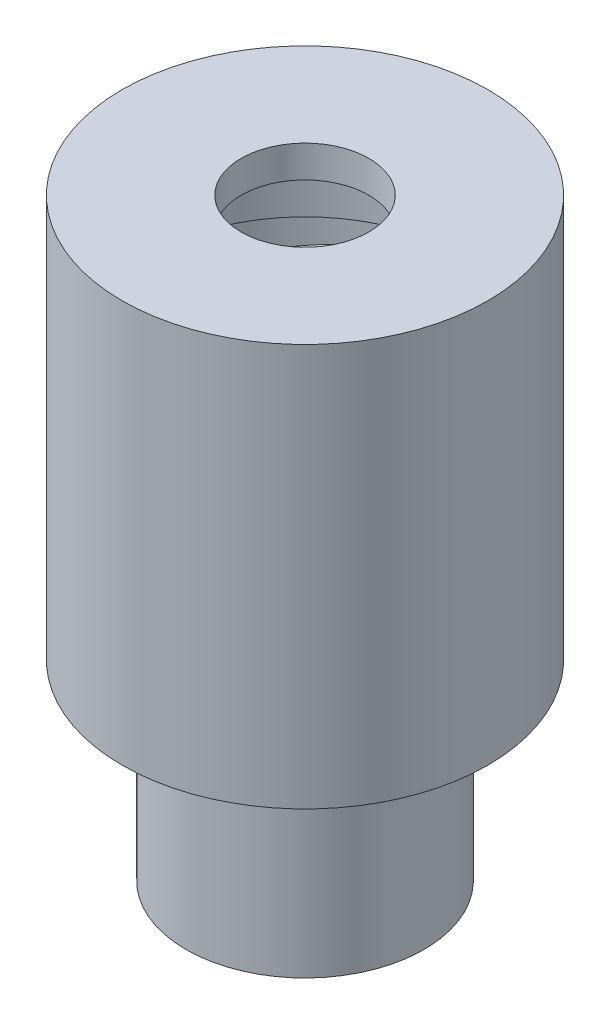
from build123d import *

# Parameters (mm, degrees)
SKETCH1_R           = 18.64
BOSS_EXTRUDE2_DEPTH = 30
SKETCH2_R           = 28.64
BOSS_EXTRUDE3_DEPTH = 15
SKETCH3_R           = 28.64
SKETCH3_R_2         = 26.64
BOSS_EXTRUDE4_DEPTH = 45
CHAMFER1_SIZE       = 2
BOSS_EXTRUDE5_START = 88
SKETCH4_R           = 28.64
BOSS_EXTRUDE5_DEPTH = 5
CHAMFER2_SIZE       = 2
BOSS_EXTRUDE6_START = 15
SKETCH5_R           = 26.64
SKETCH5_R_2         = 24.14
BOSS_EXTRUDE6_DEPTH = 15
SWEEP2_PITCH        = 15
SWEEP2_HEIGHT       = 14.25
SWEEP2_RADIUS       = 25.39
SWEEP2_START_ANGLE  = 90
SKETCH14_W          = 2.5
SKETCH14_H          = 5
SKETCH15_R          = 10
CUT_EXTRUDE1_DEPTH  = 15


with BuildPart() as part:
    # Sketch1 → Boss-Extrude2 (new body)
    with BuildSketch(Plane(origin=(0, 0, 0), x_dir=(1, 0, 0), z_dir=(0, 1, 0))):
        with Locations(Location((0, 0, 0), (0, 0, 270))):
            Circle(SKETCH1_R)
    extrude(amount=BOSS_EXTRUDE2_DEPTH)

    # Sketch2 → Boss-Extrude3 (add)
    with BuildSketch(Plane(origin=(0, 30, 0), x_dir=(1, 0, 0), z_dir=(0, 1, 0))):
        with Locations(Location((0, 0, 0), (0, 0, 270))):
            Circle(SKETCH2_R)
    extrude(amount=BOSS_EXTRUDE3_DEPTH)

    # Sketch3 → Boss-Extrude4 (add)
    with BuildSketch(Plane(origin=(0, 45, 0), x_dir=(1, 0, 0), z_dir=(0, 1, 0))):
        with Locations(Location((0, 0, 0), (0, 0, 270))):
            Circle(SKETCH3_R)
        with Locations(Location((0, 0, 0), (0, 0, 90))):
            Circle(SKETCH3_R_2, mode=Mode.SUBTRACT)
    extrude(amount=BOSS_EXTRUDE4_DEPTH)

    # Chamfer1
    chamfer1_edges = [part.edges().sort_by_distance(p)[0] for p in [
        (0, 90, 26.64),
    ]]
    chamfer(chamfer1_edges, length=CHAMFER1_SIZE - 0.0001)  # a hair under: the kernel refuses the full size



with BuildPart() as body_2:
    # Sketch4 → Boss-Extrude5 (new body)
    with BuildSketch(Plane(origin=(0, 0, 0), x_dir=(1, 0, 0), z_dir=(0, 1, 0)).offset(BOSS_EXTRUDE5_START)):
        with Locations(Location((0, 0, 0), (0, 0, 270))):
            Circle(SKETCH4_R)
    extrude(amount=BOSS_EXTRUDE5_DEPTH)

    # Chamfer2
    chamfer2_edges = [body_2.edges().sort_by_distance(p)[0] for p in [
        (0, 88, -28.64),
    ]]
    chamfer(chamfer2_edges, length=CHAMFER2_SIZE)


with BuildPart() as part_1:
    add(part.part)

    add(body_2.part)  # Boss-Extrude6 merges body 2
    # Sketch5 → Boss-Extrude6 (add)
    with BuildSketch(Plane.XZ.offset(-88).offset(BOSS_EXTRUDE6_START)):
        with Locations(Location((0, 0, 0), (0, 0, 270))):
            Circle(SKETCH5_R)
        with Locations(Location((0, 0, 0), (0, 0, 270))):
            Circle(SKETCH5_R_2, mode=Mode.SUBTRACT)
    extrude(amount=-BOSS_EXTRUDE6_DEPTH)

    # Sketch15 → Cut-Extrude1 (cut)
    with BuildSketch(Plane(origin=(0, 93, 0), x_dir=(1, 0, 0), z_dir=(0, 1, 0))):
        with Locations(Location((0, 0, 0), (0, 0, 270))):
            Circle(SKETCH15_R)
    extrude(amount=-CUT_EXTRUDE1_DEPTH, mode=Mode.SUBTRACT)


with BuildPart() as body_2_2:
    # Sweep2: sweep along a helix
    with BuildLine() as sweep2_path:
        add(Helix(SWEEP2_PITCH, SWEEP2_HEIGHT, SWEEP2_RADIUS, center=(0, 73, 0), direction=(0, -1, 0), lefthand=True, mode=Mode.PRIVATE).rotate(Axis((0, 73, 0), (0, -1, 0)), SWEEP2_START_ANGLE))
    # Sketch14 → Sweep2 (sweep)
    with BuildSketch(Plane.XY):
        with Locations((25.359475185, 70.5)):
            Rectangle(SKETCH14_W, SKETCH14_H)
    sweep(path=sweep2_path.line, is_frenet=True)


solid = Compound([part_1.part, body_2_2.part])
